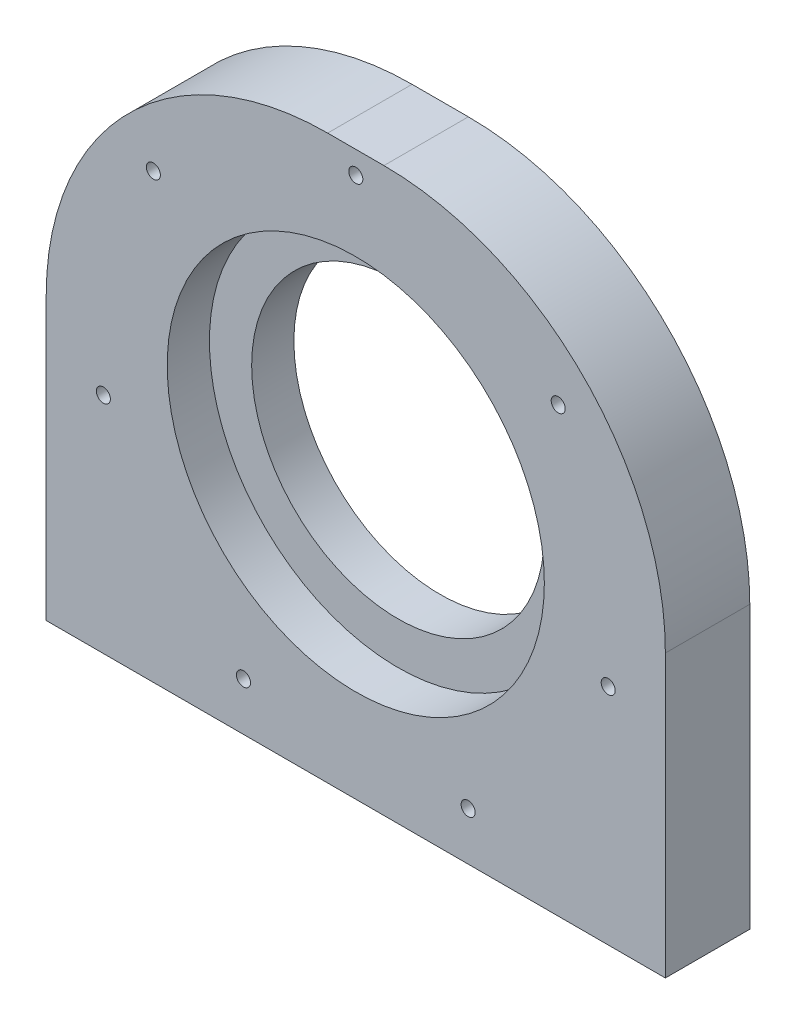
from build123d import *

# Parameters (mm, degrees)
SKIZZE1_W                       = 110
SKIZZE1_H                       = 100
AUFSATZ_LINEAR_AUSTRAGEN1_DEPTH = 15
SKIZZE2_R                       = 33.5
SCHNITT_LINEAR_AUSTRAGEN1_DEPTH = 7.5
SKIZZE3_R                       = 26
SCHNITT_LINEAR_AUSTRAGEN2_DEPTH = 7.5
SKIZZE4_R                       = 2.1
SCHNITT_LINEAR_AUSTRAGEN3_DEPTH = 10
SKIZZE5_R                       = 1.25
SCHNITT_LINEAR_AUSTRAGEN5_DEPTH = 10
VERRUNDUNG1_R                   = 50


with BuildPart() as part:
    # Skizze1 → Aufsatz-Linear austragen1 (new body)
    with BuildSketch(Plane.XY):
        with Locations((55, 50)):
            Rectangle(SKIZZE1_W, SKIZZE1_H)
    extrude(amount=AUFSATZ_LINEAR_AUSTRAGEN1_DEPTH)

    # Skizze2 → Schnitt-Linear austragen1 (cut)
    with BuildSketch(Plane.XY.offset(15)):
        with Locations((55, 50)):
            Circle(SKIZZE2_R)
    extrude(amount=-SCHNITT_LINEAR_AUSTRAGEN1_DEPTH, mode=Mode.SUBTRACT)

    # Skizze3 → Schnitt-Linear austragen2 (cut)
    with BuildSketch(Plane(origin=(0, 0, 0), x_dir=(-1, 0, 0), z_dir=(0, 0, -1))):
        with Locations((-55, 50)):
            Circle(SKIZZE3_R)
    extrude(amount=-SCHNITT_LINEAR_AUSTRAGEN2_DEPTH, mode=Mode.SUBTRACT)

    # Skizze4 → Schnitt-Linear austragen3 (cut)
    with BuildSketch(Plane.XZ):
        with Locations((25, 7.5)):
            Circle(SKIZZE4_R)
        with Locations((85, 7.5)):
            Circle(SKIZZE4_R)
        with Locations((55, 7.5)):
            Circle(SKIZZE4_R)
    extrude(amount=-SCHNITT_LINEAR_AUSTRAGEN3_DEPTH, mode=Mode.SUBTRACT)

    # Skizze5 → Schnitt-Linear austragen5 (cut)
    with BuildSketch(Plane.XY.offset(15)):
        with Locations((55, 96)):
            Circle(SKIZZE5_R)
        with Locations((90.964248194, 78.680530886)):
            Circle(SKIZZE5_R)
        with Locations((99.84668396, 39.764037038)):
            Circle(SKIZZE5_R)
        with Locations((74.958651999, 8.555432076)):
            Circle(SKIZZE5_R)
        with Locations((35.041348001, 8.555432076)):
            Circle(SKIZZE5_R)
        with Locations((10.15331604, 39.764037038)):
            Circle(SKIZZE5_R)
        with Locations((19.035751806, 78.680530886)):
            Circle(SKIZZE5_R)
    extrude(amount=-SCHNITT_LINEAR_AUSTRAGEN5_DEPTH, mode=Mode.SUBTRACT)

    # Verrundung1
    verrundung1_edges = [part.edges().sort_by_distance(p)[0] for p in [
        (110, 100, 7.5),
        (0, 100, 7.5),
    ]]
    fillet(verrundung1_edges, radius=VERRUNDUNG1_R)


solid = part.part
